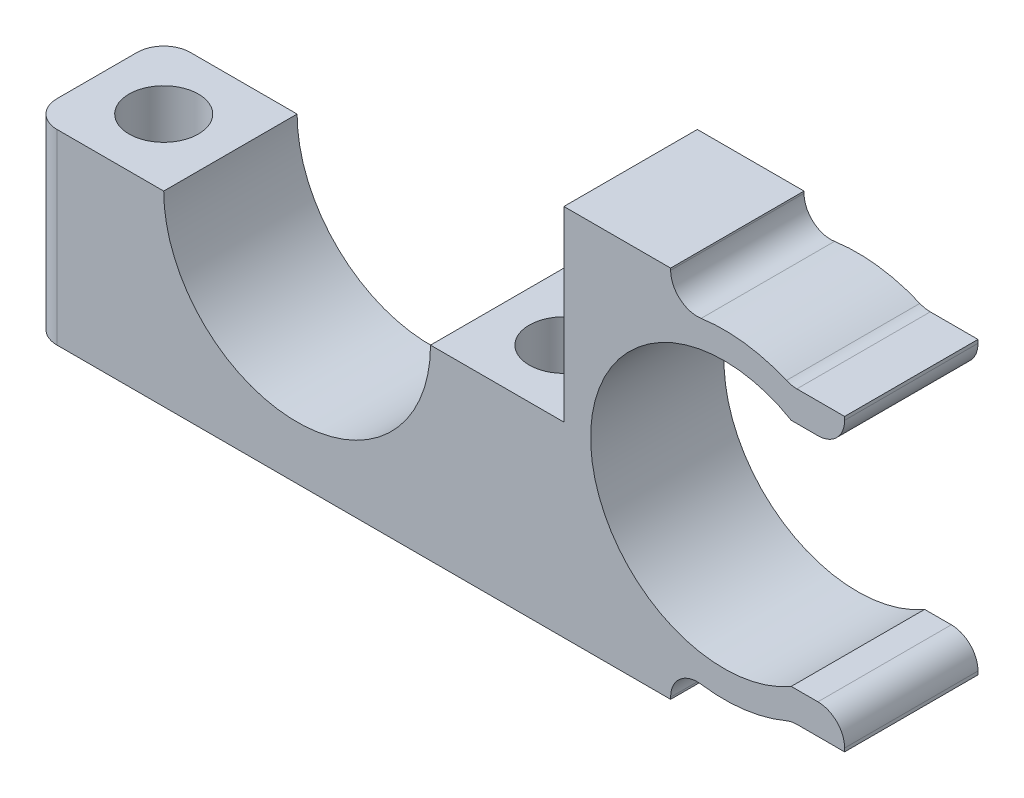
from build123d import *

# Parameters (mm, degrees)
BOSS_EXTRUDE1_DEPTH = 10
FILLET1_R           = 2
SKETCH4_R           = 2.6
CUT_EXTRUDE2_DEPTH  = 45.50093142


with BuildPart() as part:
    # Sketch1 → Boss-Extrude1 (new body)
    with BuildSketch(Plane.XY):
        with BuildLine():
            Line((10, 0), (20, 0))
            Line((20, 0), (20, 14))
            Line((20, 14), (28, 14))
            Line((28, 14), (28, 11.313708499))
            ThreePointArc((28, 11.313708499), (32.561789374, 11.986842482), (37.040624961, 10.89))
            Line((37.040624961, 10.89), (41.040624961, 10.89))
            Line((41.040624961, 10.89), (41.040624961, 8.636671813))
            Line((41.040624961, 8.636671813), (37.040624961, 8.636671813))
            ThreePointArc((37.040624961, 8.636671813), (22, 0), (37.040624961, -8.636671813))
            Line((37.040624961, -8.636671813), (41.040624961, -8.636671813))
            Line((41.040624961, -8.636671813), (41.040624961, -10.89))
            Line((41.040624961, -10.89), (37.040624961, -10.89))
            ThreePointArc((37.040624961, -10.89), (32.561789374, -11.986842482), (28, -11.313708499))
            Line((28, -11.313708499), (28, -14))
            Line((28, -14), (20, -14))
            Line((20, -14), (-20, -14))
            Line((-20, -14), (-20, 0))
            Line((-20, 0), (-10, 0))
            ThreePointArc((-10, 0), (0, -10), (10, 0))
        make_face()
    extrude(amount=BOSS_EXTRUDE1_DEPTH)

    # Fillet1
    fillet1_edges = [part.edges().sort_by_distance(p)[0] for p in [
        (41.040624961, -8.636671813, 5),
        (41.040624961, 8.636671813, 5),
        (-20, -7, 0),
        (-20, -7, 10),
        (37.040624961, 10.89, 5),
        (37.040624961, -10.89, 5),
        (28, -11.313708499, 5),
        (28, 11.313708499, 5),
    ]]
    fillet(fillet1_edges, radius=FILLET1_R)

    # Sketch4 → Cut-Extrude2 (cut, through all)
    with BuildSketch(Plane(origin=(0, 0, 0), x_dir=(1, 0, 0), z_dir=(0, 1, 0))):
        with Locations((-15, -5)):
            Circle(SKETCH4_R)
        with Locations((15, -5)):
            Circle(SKETCH4_R)
    extrude(amount=-CUT_EXTRUDE2_DEPTH, mode=Mode.SUBTRACT)


solid = part.part
